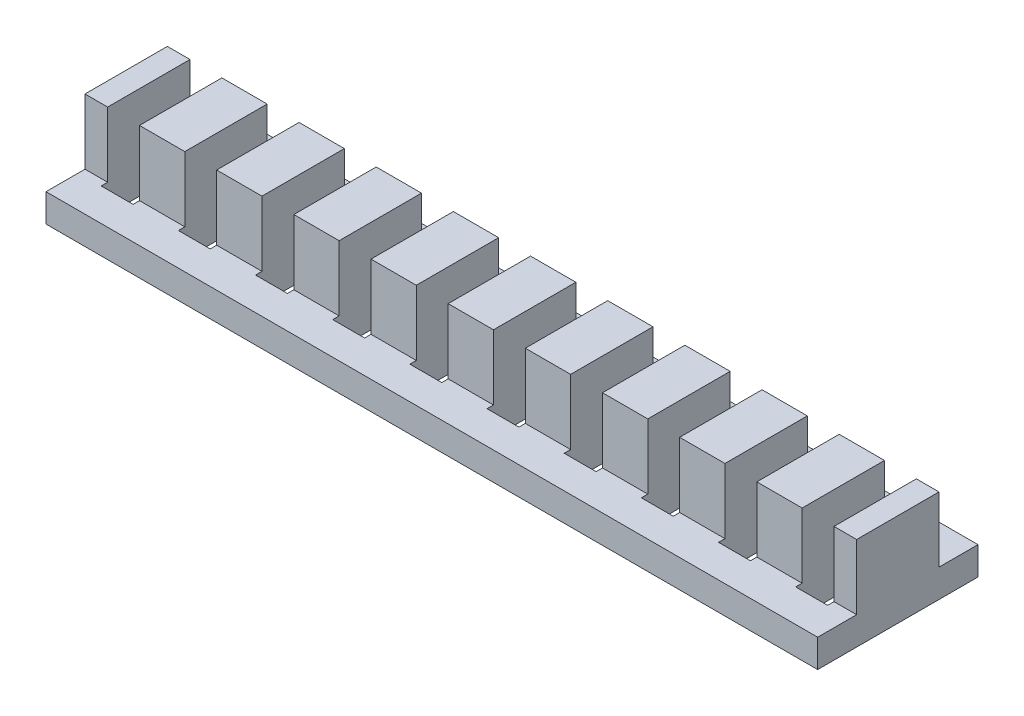
from build123d import *

# Parameters (mm, degrees)
SKETCH1_W           = 77
SKETCH1_H           = 16
BOSS_EXTRUDE1_DEPTH = 2.8
SKETCH2_W           = 77
SKETCH2_H           = 8.22
BOSS_EXTRUDE2_DEPTH = 6.5
SKETCH4_W           = 3.18
SKETCH4_H           = 9.5
CUT_EXTRUDE1_DEPTH  = 41.40717758


with BuildPart() as part:
    # Sketch1 → Boss-Extrude1 (new body)
    with BuildSketch(Plane(origin=(0, 0, 0), x_dir=(1, 0, 0), z_dir=(0, 1, 0))):
        Rectangle(SKETCH1_W, SKETCH1_H)
    extrude(amount=BOSS_EXTRUDE1_DEPTH)

    # Sketch2 → Boss-Extrude2 (add)
    with BuildSketch(Plane(origin=(0, 2.8, 0), x_dir=(1, 0, 0), z_dir=(0, 1, 0))):
        Rectangle(SKETCH2_W, SKETCH2_H)
    extrude(amount=BOSS_EXTRUDE2_DEPTH)

    # Sketch4 → Cut-Extrude1 (cut, through all)
    with BuildSketch(Plane.XZ):
        with Locations((-26.95, 0)):
            Rectangle(SKETCH4_W, SKETCH4_H)
        with Locations((-34.65, 0)):
            Rectangle(SKETCH4_W, SKETCH4_H)
        with Locations((-19.25, 0)):
            Rectangle(SKETCH4_W, SKETCH4_H)
        with Locations((-11.55, 0)):
            Rectangle(SKETCH4_W, SKETCH4_H)
        with Locations((-3.85, 0)):
            Rectangle(SKETCH4_W, SKETCH4_H)
        with Locations((3.85, 0)):
            Rectangle(SKETCH4_W, SKETCH4_H)
        with Locations((11.55, 0)):
            Rectangle(SKETCH4_W, SKETCH4_H)
        with Locations((19.25, 0)):
            Rectangle(SKETCH4_W, SKETCH4_H)
        with Locations((26.95, 0)):
            Rectangle(SKETCH4_W, SKETCH4_H)
        with Locations((34.65, 0)):
            Rectangle(SKETCH4_W, SKETCH4_H)
    extrude(amount=-CUT_EXTRUDE1_DEPTH, mode=Mode.SUBTRACT)


solid = part.part
